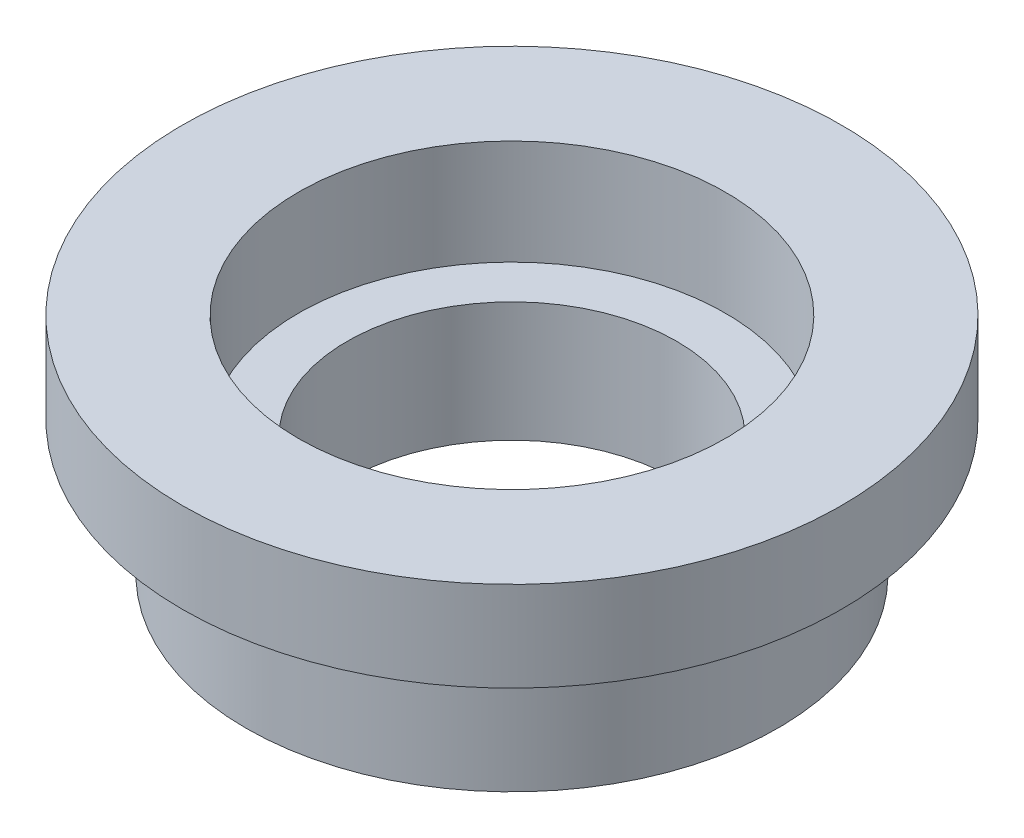
from build123d import *

# Parameters (mm, degrees)
SKETCH1_R           = 8.875
SKETCH1_R_2         = 5.5
BOSS_EXTRUDE1_DEPTH = 2
SKETCH2_R           = 9
SKETCH2_R_2         = 7.125
BOSS_EXTRUDE2_DEPTH = 3.5
BOSS_EXTRUDE3_START = -3
SKETCH3_R           = 11
SKETCH3_R_2         = 9
BOSS_EXTRUDE3_DEPTH = 3


with BuildPart() as part:
    # Sketch1 → Boss-Extrude1 (new, symmetric)
    with BuildSketch(Plane(origin=(0, 0, 0), x_dir=(1, 0, 0), z_dir=(0, 1, 0))):
        Circle(SKETCH1_R)
        Circle(SKETCH1_R_2, mode=Mode.SUBTRACT)
    extrude(amount=BOSS_EXTRUDE1_DEPTH, both=True)

    # Sketch2 → Boss-Extrude2 (add)
    with BuildSketch(Plane(origin=(0, 2, 0), x_dir=(1, 0, 0), z_dir=(0, 1, 0))):
        Circle(SKETCH2_R)
        Circle(SKETCH2_R_2, mode=Mode.SUBTRACT)
    extrude(amount=BOSS_EXTRUDE2_DEPTH)

    # Sketch3 → Boss-Extrude3 (add)
    with BuildSketch(Plane(origin=(0, 5.5, 0), x_dir=(1, 0, 0), z_dir=(0, 1, 0)).offset(BOSS_EXTRUDE3_START)):
        Circle(SKETCH3_R)
        Circle(SKETCH3_R_2, mode=Mode.SUBTRACT)
    extrude(amount=BOSS_EXTRUDE3_DEPTH)


solid = part.part
